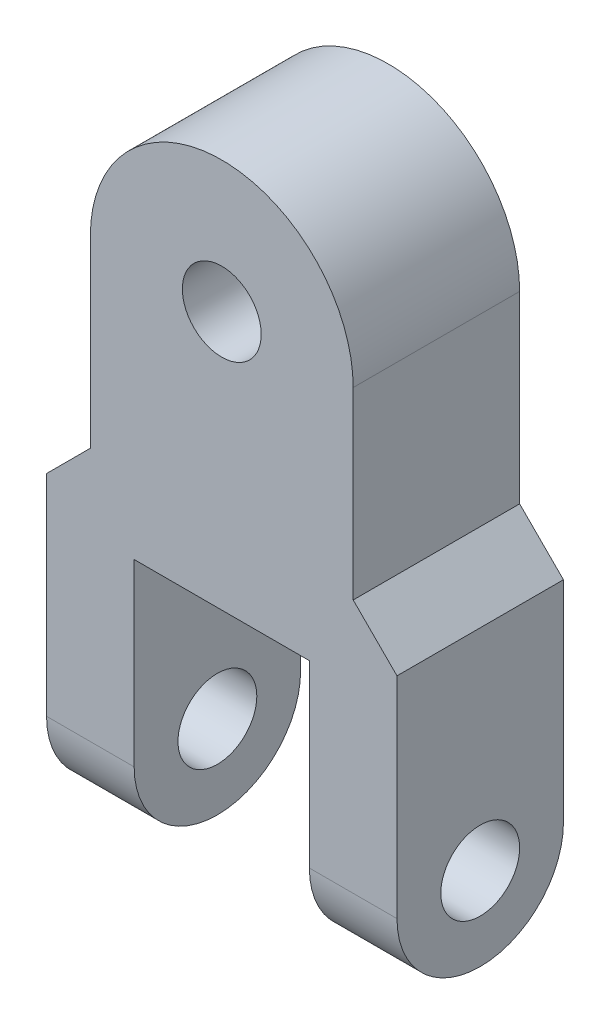
from build123d import *

# Parameters (mm, degrees)
SKETCH1_R                = 2.25
BOSS_EXTRUDE1_DEPTH      = 9.5
BOSS_EXTRUDE2_DEPTH      = 10
BOSS_EXTRUDE2_DEPTH_BACK = 10
SKETCH2_R                = 2.25
SKETCH4_W                = 10
SKETCH4_H                = 15
CUT_EXTRUDE1_DEPTH       = 25.986246217
CHAMFER1_SIZE            = 3


with BuildPart() as part:
    # Sketch1 → Boss-Extrude1 (new body)
    with BuildSketch(Plane.XY):
        with BuildLine():
            Line((0, 0), (15, 0))
            Line((15, 0), (15, 10))
            ThreePointArc((15, 10), (7.5, 17.5), (0, 10))
            Line((0, 10), (0, 0))
        make_face()
        with Locations((7.5, 10)):
            Circle(SKETCH1_R, mode=Mode.SUBTRACT)
    extrude(amount=BOSS_EXTRUDE1_DEPTH)

    # Sketch2 → Boss-Extrude2 (add, two sides: drawn at the far end of the back side and taken through both)
    with BuildSketch(Plane(origin=(7.5, 0, 0), x_dir=(0, 0, -1), z_dir=(1, 0, 0)).offset(-BOSS_EXTRUDE2_DEPTH_BACK)):
        with BuildLine():
            Line((-9.5, 0), (-9.5, -15))
            ThreePointArc((-9.5, -15), (-4.75, -19.75), (0, -15))
            Line((0, -15), (0, 0))
            Line((0, 0), (-9.5, 0))
        make_face()
        with Locations((-4.75, -15)):
            Circle(SKETCH2_R, mode=Mode.SUBTRACT)
    extrude(amount=BOSS_EXTRUDE2_DEPTH + BOSS_EXTRUDE2_DEPTH_BACK)

    # Sketch4 → Cut-Extrude1 (cut, through all)
    with BuildSketch(Plane(origin=(5.5, 0, 9.5), x_dir=(-1, 0, 0), z_dir=(0, 0, -1))):
        with Locations((-2, -12.25)):
            Rectangle(SKETCH4_W, SKETCH4_H)
    extrude(amount=CUT_EXTRUDE1_DEPTH, mode=Mode.SUBTRACT)

    # Chamfer1
    # the kernel refuses this chamfer: 3 mm, written as the material it takes off along each edge
    with BuildSketch(Plane(origin=(-2.5, 0, -7.715048964), x_dir=(0.9996219169112968, 0.027495876610586372, 0), z_dir=(0, 0, 1))) as chamfer1_piece_1_section:
        Polygon((CHAMFER1_SIZE * 0.999621916911, -CHAMFER1_SIZE * 0.0274958766106), (-CHAMFER1_SIZE * 0.0274958766106, -CHAMFER1_SIZE * 0.999621916911), (0, 0), align=None)
    chamfer1_piece_1 = extrude(amount=24.930097928, mode=Mode.PRIVATE)
    chamfer1_piece_1 = split(chamfer1_piece_1, bisect_by=Plane(origin=(0, -1.026079574, 4.75), z_dir=(-1, 0, 0)), keep=Keep.TOP, mode=Mode.PRIVATE)
    add(chamfer1_piece_1, mode=Mode.SUBTRACT)
    with BuildSketch(Plane(origin=(17.5, 0, -7.715048964), x_dir=(0.027495876610586778, -0.9996219169112968, 0), z_dir=(0, 0, 1))) as chamfer1_piece_2_section:
        Polygon((CHAMFER1_SIZE * 0.999621916911, -CHAMFER1_SIZE * 0.0274958766106), (-CHAMFER1_SIZE * 0.0274958766106, -CHAMFER1_SIZE * 0.999621916911), (0, 0), align=None)
    chamfer1_piece_2 = extrude(amount=24.930097928, mode=Mode.PRIVATE)
    chamfer1_piece_2 = split(chamfer1_piece_2, bisect_by=Plane(origin=(15, -1.026079574, 4.75), z_dir=(1, 0, 0)), keep=Keep.TOP, mode=Mode.PRIVATE)
    add(chamfer1_piece_2, mode=Mode.SUBTRACT)


solid = part.part
